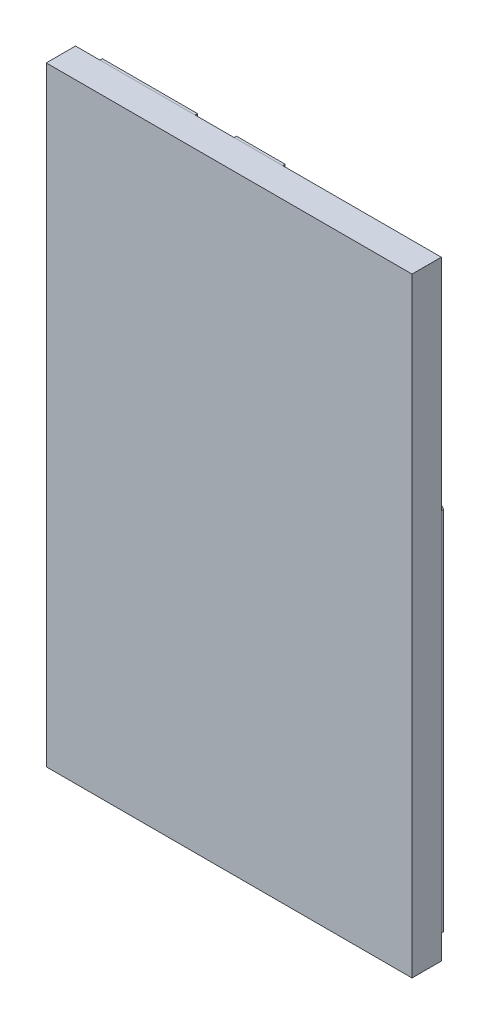
from build123d import *

# Parameters (mm, degrees)
SKETCH1_W             = 15
SKETCH1_H             = 25
BOSS_EXTRUDE1_DEPTH   = 1.2
BOSS_EXTRUDE2_DEPTH   = 0.1
BOSS_EXTRUDE2_2_DEPTH = 0.1
BOSS_EXTRUDE2_3_DEPTH = 0.1
BOSS_EXTRUDE2_4_DEPTH = 0.1
SKETCH3_W             = 2
SKETCH3_H             = 4
BOSS_EXTRUDE3_DEPTH   = 0.1
CHAMFER5_SIZE         = 1
CHAMFER6_SIZE         = 1
CHAMFER7_SIZE         = 1
CHAMFER8_SIZE         = 1


with BuildPart() as part:
    # Sketch1 → Boss-Extrude1 (new body)
    with BuildSketch(Plane.XY):
        with Locations((7.5, -12.5)):
            Rectangle(SKETCH1_W, SKETCH1_H)
    extrude(amount=BOSS_EXTRUDE1_DEPTH)


with BuildPart() as body_2:
    # Sketch2 → Boss-Extrude2 (new body)
    with BuildSketch(Plane(origin=(0, 0, 0), x_dir=(-1, 0, 0), z_dir=(0, 0, -1))):
        Polygon((-6.5, -17), (-11.4, -17), (-11.4, -15), (-4, -15), (-4, -17), (-4.5, -17), (-4.5, -25), (-6.5, -25), align=None)
    extrude(amount=BOSS_EXTRUDE2_DEPTH)

    # Chamfer6
    # the kernel refuses this chamfer: 1 mm, written as the material it adds along each edge
    with BuildSketch(Plane(origin=(6.5, -17, 0), x_dir=(0.9996219169112968, 0.027495876610585623, 0), z_dir=(0, 0, -1))) as chamfer6_piece_1:
        Polygon((CHAMFER6_SIZE * 0.999621916911, CHAMFER6_SIZE * 0.0274958766106), (-CHAMFER6_SIZE * 0.0274958766106, CHAMFER6_SIZE * 0.999621916911), (0, 0), align=None)
    extrude(amount=0.1)
    with BuildSketch(Plane(origin=(4.5, -17, 0), x_dir=(-0.9996219169112968, 0.027495876610585623, 0), z_dir=(0, 0, -1))) as chamfer6_piece_2_section:
        Polygon((CHAMFER6_SIZE * 0.999621916911, -CHAMFER6_SIZE * 0.0274958766106), (-CHAMFER6_SIZE * 0.0274958766106, -CHAMFER6_SIZE * 0.999621916911), (0, 0), align=None)
    chamfer6_piece_2 = extrude(amount=0.1, mode=Mode.PRIVATE)
    chamfer6_piece_2 = split(chamfer6_piece_2, bisect_by=Plane(origin=(4, -17.393401084, -0.05), z_dir=(1, 0, 0)), keep=Keep.TOP, mode=Mode.PRIVATE)
    add(chamfer6_piece_2)


with BuildPart() as body_3:
    # Sketch2 → Boss-Extrude2 2 (new body)
    with BuildSketch(Plane(origin=(0, 0, 0), x_dir=(-1, 0, 0), z_dir=(0, 0, -1))):
        Polygon((-4.9, 0), (0, 0), (0, -17), (-2, -17), (-2, -2), (-4.9, -2), align=None)
    extrude(amount=BOSS_EXTRUDE2_2_DEPTH)

    # Chamfer7
    chamfer7_edges = [body_3.edges().sort_by_distance(p)[0] for p in [
        (0, 0, -0.05),
        (0, -17, -0.05),
        (2, -2, -0.05),
    ]]
    chamfer(chamfer7_edges, length=CHAMFER7_SIZE)


with BuildPart() as body_4:
    # Sketch2 → Boss-Extrude2 3 (new body)
    with BuildSketch(Plane(origin=(0, 0, 0), x_dir=(-1, 0, 0), z_dir=(0, 0, -1))):
        Polygon((-8.5, 0), (-6.5, 0), (-6.5, -8), (-3.6, -8), (-3.6, -10), (-7.5, -10), (-11, -10), (-11, -8), (-8.5, -8), align=None)
    extrude(amount=BOSS_EXTRUDE2_3_DEPTH)

    # Chamfer8
    chamfer8_edges = [body_4.edges().sort_by_distance(p)[0] for p in [
        (8.5, -8, -0.05),
        (6.5, -8, -0.05),
    ]]
    chamfer(chamfer8_edges, length=CHAMFER8_SIZE)


with BuildPart() as body_5:
    # Sketch2 → Boss-Extrude2 4 (new body)
    with BuildSketch(Plane(origin=(0, 0, 0), x_dir=(-1, 0, 0), z_dir=(0, 0, -1))):
        Polygon((-8.5, -25), (-8.5, -23), (-13, -23), (-13, -8), (-15, -8), (-15, -25), align=None)
    extrude(amount=BOSS_EXTRUDE2_4_DEPTH)

    # Sketch3 → Boss-Extrude3 (add)
    with BuildSketch(Plane(origin=(0, 0, 0), x_dir=(-1, 0, 0), z_dir=(0, 0, -1))):
        with Locations((-9.5, -21)):
            Rectangle(SKETCH3_W, SKETCH3_H)
    extrude(amount=BOSS_EXTRUDE3_DEPTH)

    # Chamfer5
    chamfer5_edges = [body_5.edges().sort_by_distance(p)[0] for p in [
        (13, -23, -0.05),
        (15, -25, -0.05),
        (15, -8, -0.05),
        (10.5, -23, -0.05),
    ]]
    chamfer(chamfer5_edges, length=CHAMFER5_SIZE)


solid = Compound([part.part, body_2.part, body_3.part, body_4.part, body_5.part])
